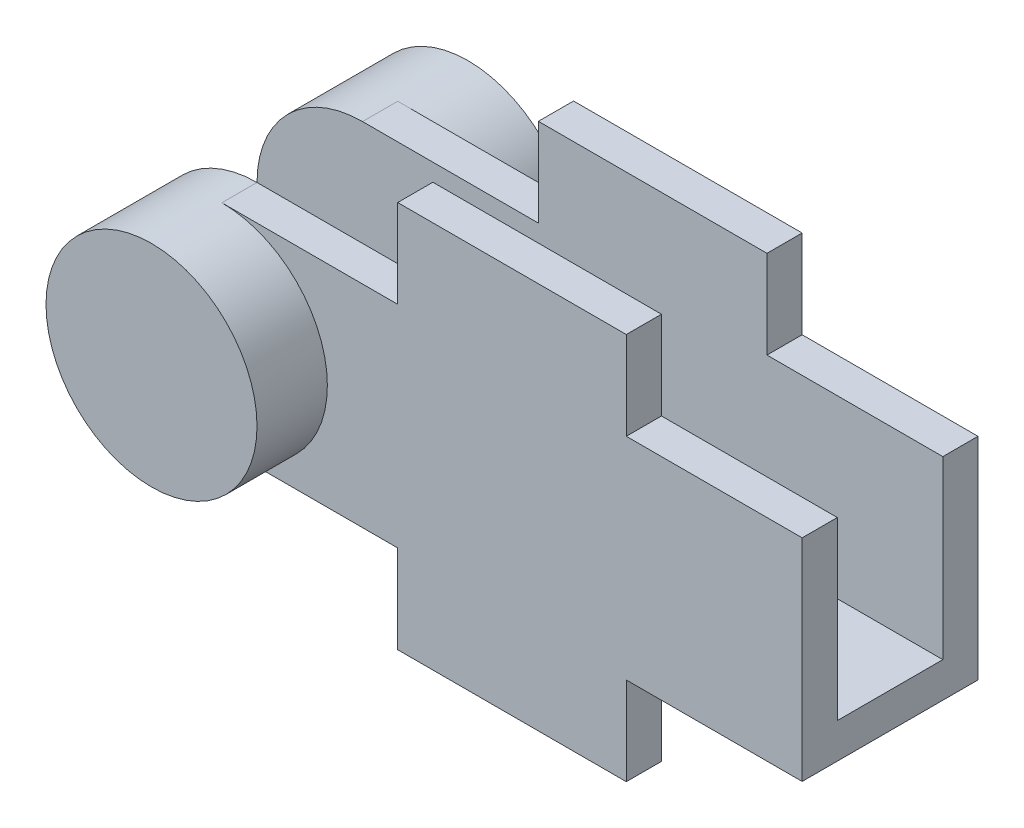
from build123d import *

# Parameters (mm, degrees)
BOSS_EXTRUDE1_DEPTH = 10
SKETCH2_R           = 30
BOSS_EXTRUDE2_DEPTH = 20
SKETCH3_W           = 165
SKETCH3_H           = 50
BOSS_EXTRUDE3_DEPTH = 10


with BuildPart() as part:
    # Sketch1 → Boss-Extrude1 (new body)
    with BuildSketch(Plane.XY):
        with BuildLine():
            Line((-165, 30), (-215, 30))
            ThreePointArc((-215, 30), (-245, 0), (-215, -30))
            Line((-215, -30), (-165, -30))
            Line((-165, -30), (-165, -55.06097561))
            Line((-165, -55.06097561), (-100, -55.06097561))
            Line((-100, -55.06097561), (-100, -30))
            Line((-100, -30), (-50, -30))
            Line((-50, -30), (-50, 30))
            Line((-50, 30), (-100, 30))
            Line((-100, 30), (-100, 55.06097561))
            Line((-100, 55.06097561), (-165, 55.06097561))
            Line((-165, 55.06097561), (-165, 30))
        make_face()
    boss_extrude1 = extrude(amount=BOSS_EXTRUDE1_DEPTH)

    # Sketch2 → Boss-Extrude2 (add)
    with BuildSketch(Plane.XY.offset(10)):
        with Locations((-215, 0)):
            Circle(SKETCH2_R)
    boss_extrude2 = extrude(amount=BOSS_EXTRUDE2_DEPTH)

    # Sketch3 → Boss-Extrude3 (add)
    with BuildSketch(Plane.XZ.offset(30)):
        with Locations((-132.5, -15)):
            Rectangle(SKETCH3_W, SKETCH3_H)
    extrude(amount=-BOSS_EXTRUDE3_DEPTH)

    # Mirror1: Boss-Extrude1, Boss-Extrude2 across plane
    add(boss_extrude1.mirror(Plane.XY.offset(-15)))
    add(boss_extrude2.mirror(Plane.XY.offset(-15)))


solid = part.part
